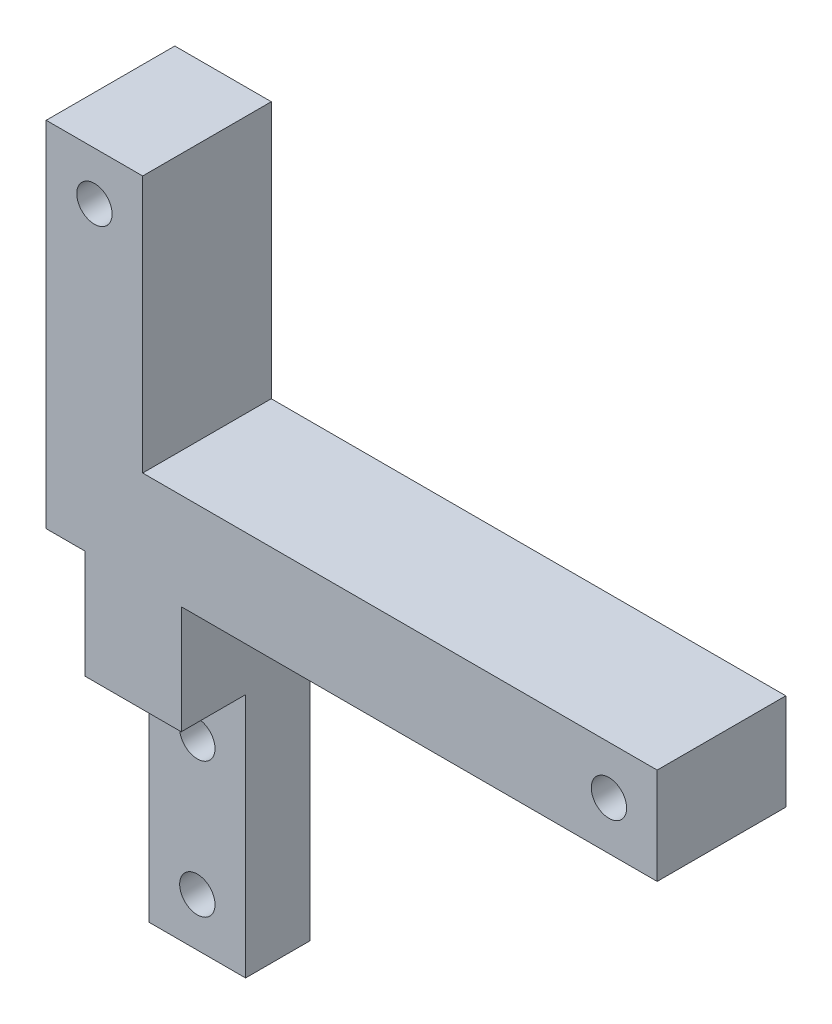
from build123d import *

# Parameters (mm, degrees)
SKETCH_1_R          = 0.55
EXTRUDE_1_DEPTH     = 4
CUT_EXTRUDE_START   = -2
SKETCH_2_W          = 3
SKETCH_2_H          = 7.631287185
SKETCH_2_R          = 0.55
CUT_EXTRUDE_1_DEPTH = 2


with BuildPart() as part:
    # 草图1 → 凸台-拉伸1 (new body)
    with BuildSketch(Plane.XY):
        Polygon((-5.3, -1.5), (9.5, -1.5), (9.5, 1.5), (-6.5, 1.5), (-6.5, 9.5), (-9.5, 9.5), (-9.5, 1.5), (-9.5, -1.5), (-8.3, -1.5), (-8.3, -12.5), (-5.3, -12.5), align=None)
        with Locations((8, 0)):
            Circle(SKETCH_1_R, mode=Mode.SUBTRACT)
        with Locations((-8, 8)):
            Circle(SKETCH_1_R, mode=Mode.SUBTRACT)
        with Locations((-6.8, -11)):
            Circle(SKETCH_1_R, mode=Mode.SUBTRACT)
        with Locations((-6.8, -6.8)):
            Circle(SKETCH_1_R, mode=Mode.SUBTRACT)
    extrude(amount=EXTRUDE_1_DEPTH)

    # 草图2 → 切除-拉伸1 (cut)
    with BuildSketch(Plane.XY.offset(4).offset(CUT_EXTRUDE_START)):
        with Locations((-6.8, -8.684356408)):
            Rectangle(SKETCH_2_W, SKETCH_2_H)
        with Locations((-6.8, -11)):
            Circle(SKETCH_2_R, mode=Mode.SUBTRACT)
        with Locations((-6.8, -6.8)):
            Circle(SKETCH_2_R, mode=Mode.SUBTRACT)
    extrude(amount=CUT_EXTRUDE_1_DEPTH, mode=Mode.SUBTRACT)


solid = part.part
